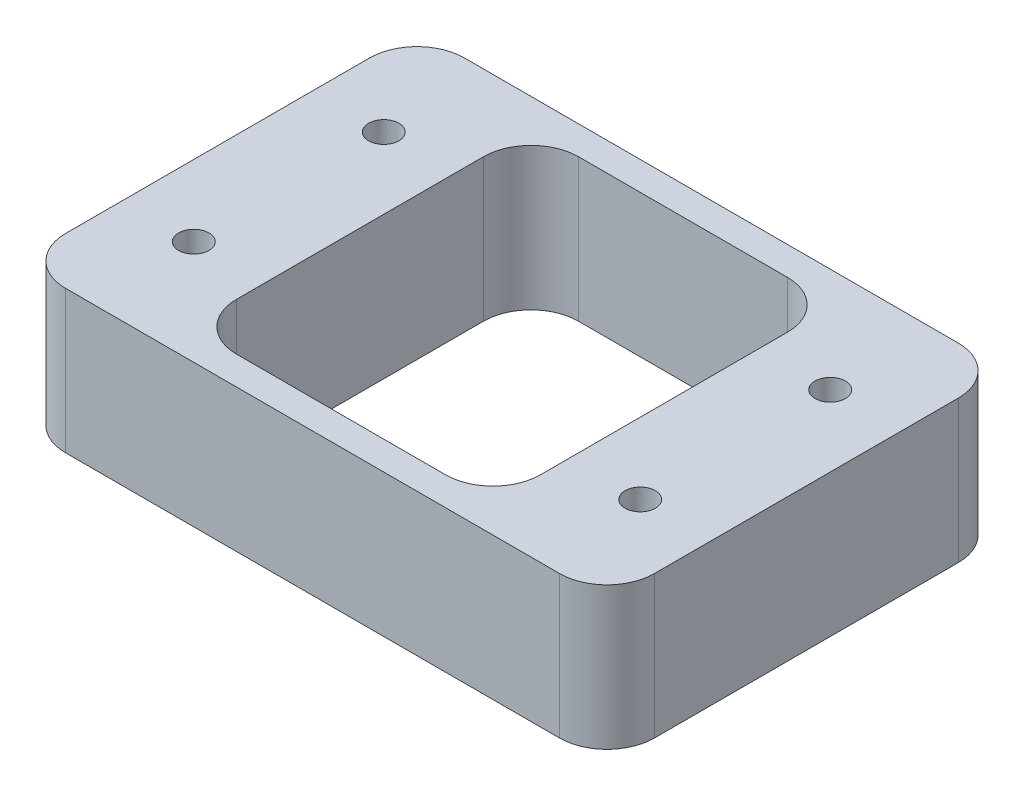
from build123d import *

# Parameters (mm, degrees)
SKETCH1_W           = 62
SKETCH1_H           = 42
SKETCH1_R           = 1.6
BOSS_EXTRUDE1_DEPTH = 15
SKETCH2_W           = 32
SKETCH2_H           = 36
CUT_EXTRUDE1_DEPTH  = 77.374079373
FILLET1_R           = 5


with BuildPart() as part:
    # Sketch1 → Boss-Extrude1 (new body)
    with BuildSketch(Plane(origin=(0, 0, 0), x_dir=(1, 0, 0), z_dir=(0, 1, 0))):
        with Locations((31, 21)):
            Rectangle(SKETCH1_W, SKETCH1_H)
        with Locations((7.5, 31)):
            Circle(SKETCH1_R, mode=Mode.SUBTRACT)
        with Locations((7.5, 11)):
            Circle(SKETCH1_R, mode=Mode.SUBTRACT)
        with Locations((54.5, 11)):
            Circle(SKETCH1_R, mode=Mode.SUBTRACT)
        with Locations((54.5, 31)):
            Circle(SKETCH1_R, mode=Mode.SUBTRACT)
    extrude(amount=BOSS_EXTRUDE1_DEPTH)

    # Sketch2 → Cut-Extrude1 (cut, through all)
    with BuildSketch(Plane(origin=(0, 15, 0), x_dir=(1, 0, 0), z_dir=(0, 1, 0))):
        with Locations((31, 21)):
            Rectangle(SKETCH2_W, SKETCH2_H)
    extrude(amount=-CUT_EXTRUDE1_DEPTH, mode=Mode.SUBTRACT)

    # Fillet1
    fillet1_edges = [part.edges().sort_by_distance(p)[0] for p in [
        (0, 7.5, -42),
        (62, 7.5, -42),
        (62, 7.5, 0),
        (0, 7.5, 0),
        (47, 7.5, -3),
        (15, 7.5, -39),
        (47, 7.5, -39),
        (15, 7.5, -3),
    ]]
    fillet(fillet1_edges, radius=FILLET1_R)


solid = part.part
